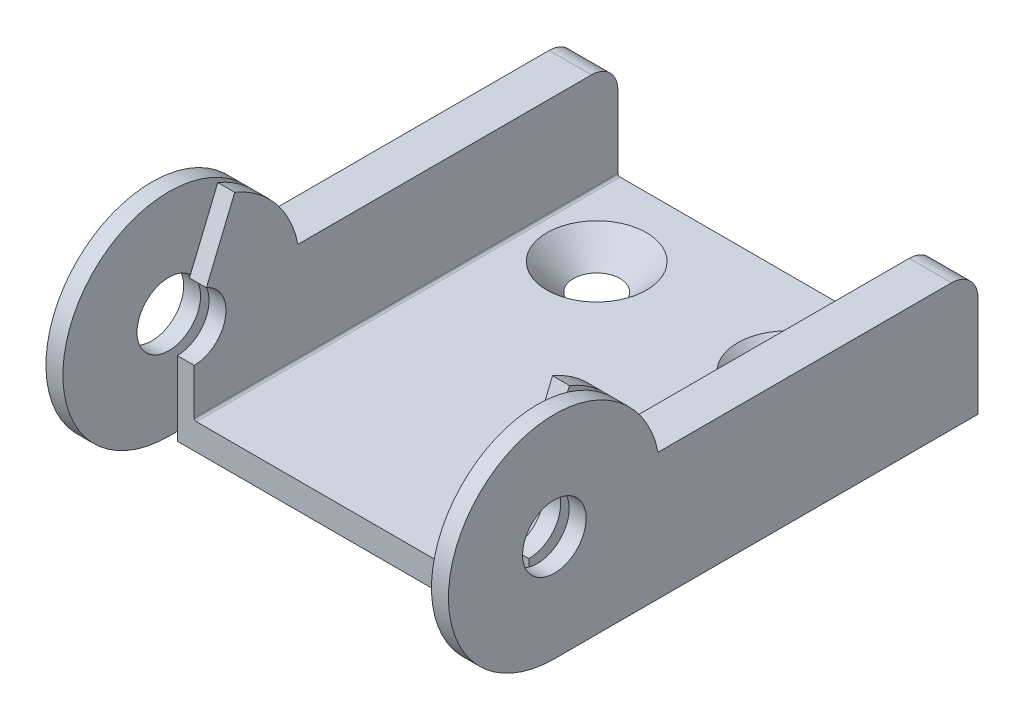
from build123d import *

# Parameters (mm, degrees)
BOSS_EXTRUDE5_START         = -16.6
BOSS_EXTRUDE5_DEPTH         = 33.2
BOSS_EXTRUDE6_DEPTH         = 0.8
BOSS_EXTRUDE7_DEPTH         = 1.6
FILLET16_R                  = 0.4
SKETCH6_R                   = 3
CUT_EXTRUDE2_DEPTH          = 46.398237851
FILLET16_OF_MIRROR1_R       = 0.4
CUT_EXTRUDE3_DEPTH          = 46.398237851
CUT_EXTRUDE3_DEPTH_BACK     = 46.398237851
FILLET_1_R                  = 2.5
HOLE_WIZARD_M42_D           = 4.2
HOLE_WIZARD_M42_DEPTH       = 8.5
HOLE_WIZARD_M42_CSINK_D     = 9.4
HOLE_WIZARD_M42_CSINK_ANGLE = 90
HOLE_WIZARD_M42_TIP         = 1.2618073


# Read off the part's stored shape, not the designer's step: Boss-Extrude5
with BuildPart() as part:
    # Boss-Extrude5 outline → Boss-Extrude5 (new body)
    with BuildSketch(Plane(origin=(0, 0, 0), x_dir=(0, 0, -1), z_dir=(1, 0, 0)).offset(BOSS_EXTRUDE5_START)):
        with BuildLine():
            Line((3.826834324, 9.238795325), (0, 0))
            Line((0, 0), (0, -10))
            Line((0, -10), (40, -10))
            Line((40, -10), (40, 2))
            Line((40, 2), (9.797958971, 2))
            ThreePointArc((9.797958971, 2), (7.7141939, 6.36327058), (3.826834324, 9.238795325))
        make_face()
    extrude(amount=BOSS_EXTRUDE5_DEPTH)

    # Sketch9 → Boss-Extrude6 (add)
    with BuildSketch(Plane(origin=(16.6, 0, 0), x_dir=(0, 0, -1), z_dir=(1, 0, 0))):
        with BuildLine():
            Line((6, 7.2), (6.939740629, 7.2))
            ThreePointArc((6.939740629, 7.2), (8.763426669, 4.816882085), (9.797958971, 2))
            Line((9.797958971, 2), (40, 2))
            Line((40, 2), (40, -7.2))
            Line((40, -7.2), (6, -7.2))
            Line((6, -7.2), (6, 7.2))
        make_face()
    boss_extrude6 = extrude(amount=BOSS_EXTRUDE6_DEPTH)

    # Sketch10 → Boss-Extrude7 (add)
    with BuildSketch(Plane(origin=(17.4, 0, 0), x_dir=(0, 0, -1), z_dir=(1, 0, 0))):
        with BuildLine():
            Line((40, 2), (40, -10))
            Line((40, -10), (0, -10))
            ThreePointArc((0, -10), (-10, 0), (0, 10))
            ThreePointArc((0, 10), (6.32455532, 7.745966692), (9.797958971, 2))
            Line((9.797958971, 2), (40, 2))
        make_face()
    boss_extrude7 = extrude(amount=BOSS_EXTRUDE7_DEPTH)

    # Fillet16
    # the kernel refuses this fillet: 0.4 mm, written as the material it takes off along each edge
    with BuildSketch(Plane(origin=(16.6, 7.2, -6), x_dir=(0, -1, 0), z_dir=(1, 0, 0)), Plane(origin=(16.6, -7.2, -6), x_dir=(0, 0, -1), z_dir=(1, 0, 0))) as fillet16_piece_1:
        with BuildLine():
            CenterArc((FILLET16_R, FILLET16_R), FILLET16_R, 180, 90)
            Line((0, FILLET16_R), (0, 0))
            Line((0, 0), (FILLET16_R, 0))
        make_face()
    extrude(amount=0.8, mode=Mode.SUBTRACT)
    # the kernel refuses this fillet: 0.4 mm, written as the material it adds along each edge
    with BuildSketch(Plane(origin=(16.6, -6.8, -6), x_dir=(0, 0, 1), z_dir=(0, 1, 0))) as fillet16_2_piece_1:
        with BuildLine():
            CenterArc((FILLET16_R, FILLET16_R), FILLET16_R, 180, 90)
            Line((0, FILLET16_R), (0, 0))
            Line((0, 0), (FILLET16_R, 0))
        make_face()
    extrude(amount=13.6)
    with BuildSketch(Plane(origin=(16.6, -7.2, -40), x_dir=(0, -1, 0), z_dir=(0, 0, 1))) as fillet16_2_piece_2:
        with BuildLine():
            CenterArc((FILLET16_R, FILLET16_R), FILLET16_R, 180, 90)
            Line((0, FILLET16_R), (0, 0))
            Line((0, 0), (FILLET16_R, 0))
        make_face()
    extrude(amount=33.6)
    with BuildSketch(Plane(origin=(16.6, 7.2, -6.4), x_dir=(0, 1, 0), z_dir=(0, 0, -1))) as fillet16_2_piece_3_section:
        with BuildLine():
            CenterArc((FILLET16_R, FILLET16_R), FILLET16_R, 180, 90)
            Line((0, FILLET16_R), (0, 0))
            Line((0, 0), (FILLET16_R, 0))
        make_face()
    fillet16_2_piece_3 = extrude(amount=1.539740629, mode=Mode.PRIVATE)
    fillet16_2_piece_3 = fillet16_2_piece_3 & Plane(origin=(16.701201478, 1e-09, -1e-09), x_dir=(0, 0.1999999999466582, -0.9797958971241596), z_dir=(-1, 0, 0)) * Cylinder(9.999999999, 5, mode=Mode.PRIVATE)
    add(fillet16_2_piece_3)
    with BuildSketch(Plane(origin=(17.4, -6.8, -6), x_dir=(0, 0, 1), z_dir=(0, 1, 0))) as fillet16_2_piece_4:
        with BuildLine():
            CenterArc((FILLET16_R, -FILLET16_R), FILLET16_R, 90, 90)
            Line((0, -FILLET16_R), (0, 0))
            Line((0, 0), (FILLET16_R, 0))
        make_face()
    extrude(amount=13.6)
    with BuildSketch(Plane(origin=(17.4, -7.2, -40), x_dir=(0, -1, 0), z_dir=(0, 0, 1))) as fillet16_2_piece_5:
        with BuildLine():
            CenterArc((FILLET16_R, -FILLET16_R), FILLET16_R, 90, 90)
            Line((0, -FILLET16_R), (0, 0))
            Line((0, 0), (FILLET16_R, 0))
        make_face()
    extrude(amount=33.6)
    with BuildSketch(Plane(origin=(17.4, 7.2, -6.4), x_dir=(-1, 0, 0), z_dir=(0, 0, -1))) as fillet16_2_piece_6_section:
        with BuildLine():
            CenterArc((FILLET16_R, FILLET16_R), FILLET16_R, 180, 90)
            Line((0, FILLET16_R), (0, 0))
            Line((0, 0), (FILLET16_R, 0))
        make_face()
    fillet16_2_piece_6 = extrude(amount=1.539740629, mode=Mode.PRIVATE)
    fillet16_2_piece_6 = fillet16_2_piece_6 & Plane(origin=(17.298798559, 1e-09, -1e-09), x_dir=(0, 0.1999999999466582, -0.9797958971241596), z_dir=(-1, 0, 0)) * Cylinder(9.999999999, 5, mode=Mode.PRIVATE)
    add(fillet16_2_piece_6)
    with BuildSketch(Plane(origin=(17.4, 6.8, -6.4), x_dir=(0, 0, 1), z_dir=(0, -1, 0))) as fillet16_2_piece_7:
        with BuildLine():
            CenterArc((0.4 + FILLET16_R, FILLET16_R), FILLET16_R, 180, 90)
            Line((0.4, FILLET16_R), (0.4, 0))
            Line((0.4, 0), (0.4 + FILLET16_R, 0))
        make_face()
    revolve(axis=Axis((17.4, 6.8, -6.4), (-1, 0, 0)), revolution_arc=90)
    with BuildSketch(Plane(origin=(17.4, -6.8, -6.4), x_dir=(0, -1, 0), z_dir=(0, 0, -1))) as fillet16_2_piece_8:
        with BuildLine():
            CenterArc((0.4 + FILLET16_R, FILLET16_R), FILLET16_R, 180, 90)
            Line((0.4, FILLET16_R), (0.4, 0))
            Line((0.4, 0), (0.4 + FILLET16_R, 0))
        make_face()
    revolve(axis=Axis((17.4, -6.8, -6.4), (-1, 0, 0)), revolution_arc=90)
    with BuildSketch(Plane(origin=(16.6, 6.8, -6.4), x_dir=(0, 0, 1), z_dir=(0, -1, 0))) as fillet16_2_piece_9:
        with BuildLine():
            CenterArc((0.4 + FILLET16_R, -FILLET16_R), FILLET16_R, 90, 90)
            Line((0.4, -FILLET16_R), (0.4, 0))
            Line((0.4, 0), (0.4 + FILLET16_R, 0))
        make_face()
    revolve(axis=Axis((16.6, 6.8, -6.4), (-1, 0, 0)), revolution_arc=90)
    with BuildSketch(Plane(origin=(16.6, -6.8, -6.4), x_dir=(0, -1, 0), z_dir=(0, 0, -1))) as fillet16_2_piece_10:
        with BuildLine():
            CenterArc((0.4 + FILLET16_R, -FILLET16_R), FILLET16_R, 90, 90)
            Line((0.4, -FILLET16_R), (0.4, 0))
            Line((0.4, 0), (0.4 + FILLET16_R, 0))
        make_face()
    revolve(axis=Axis((16.6, -6.8, -6.4), (-1, 0, 0)), revolution_arc=90)

    # Sketch6 → Cut-Extrude2 (cut, through all)
    with BuildSketch(Plane(origin=(0, 0, 0), x_dir=(0, 0, -1), z_dir=(1, 0, 0))):
        Circle(SKETCH6_R)
    cut_extrude2 = extrude(amount=CUT_EXTRUDE2_DEPTH, mode=Mode.SUBTRACT)

    # Mirror1: Boss-Extrude6, Boss-Extrude7, Cut-Extrude2 across plane
    add(boss_extrude6.mirror(Plane(origin=(0, 0, 0), x_dir=(0, 0, 1), z_dir=(1, 0, 0))))
    add(boss_extrude7.mirror(Plane(origin=(0, 0, 0), x_dir=(0, 0, 1), z_dir=(1, 0, 0))))
    add(cut_extrude2.mirror(Plane(origin=(0, 0, 0), x_dir=(0, 0, 1), z_dir=(1, 0, 0))), mode=Mode.SUBTRACT)

    # Fillet16 of Mirror1
    # the kernel refuses this fillet: 0.4 mm, written as the material it takes off along each edge
    with BuildSketch(Plane(origin=(-16.6, 7.2, -6), x_dir=(0, 0, -1), z_dir=(-1, 0, 0)), Plane(origin=(-16.6, -7.2, -6), x_dir=(0, 1, 0), z_dir=(-1, 0, 0))) as fillet16_of_mirror1_piece_1:
        with BuildLine():
            CenterArc((FILLET16_OF_MIRROR1_R, FILLET16_OF_MIRROR1_R), FILLET16_OF_MIRROR1_R, 180, 90)
            Line((0, FILLET16_OF_MIRROR1_R), (0, 0))
            Line((0, 0), (FILLET16_OF_MIRROR1_R, 0))
        make_face()
    extrude(amount=0.8, mode=Mode.SUBTRACT)
    # the kernel refuses this fillet: 0.4 mm, written as the material it adds along each edge
    with BuildSketch(Plane(origin=(-16.6, -6.8, -6), x_dir=(-1, 0, 0), z_dir=(0, 1, 0))) as fillet16_of_mirror1_2_piece_1:
        with BuildLine():
            CenterArc((FILLET16_OF_MIRROR1_R, FILLET16_OF_MIRROR1_R), FILLET16_OF_MIRROR1_R, 180, 90)
            Line((0, FILLET16_OF_MIRROR1_R), (0, 0))
            Line((0, 0), (FILLET16_OF_MIRROR1_R, 0))
        make_face()
    extrude(amount=13.6)
    with BuildSketch(Plane(origin=(-16.6, -7.2, -40), x_dir=(-1, 0, 0), z_dir=(0, 0, 1)), Plane(origin=(-17.4, -7.2, -40), x_dir=(0, -1, 0), z_dir=(0, 0, 1))) as fillet16_of_mirror1_2_piece_2:
        with BuildLine():
            CenterArc((FILLET16_OF_MIRROR1_R, FILLET16_OF_MIRROR1_R), FILLET16_OF_MIRROR1_R, 180, 90)
            Line((0, FILLET16_OF_MIRROR1_R), (0, 0))
            Line((0, 0), (FILLET16_OF_MIRROR1_R, 0))
        make_face()
    extrude(amount=33.6)
    with BuildSketch(Plane(origin=(-16.6, 7.2, -6.4), x_dir=(-1, 0, 0), z_dir=(0, 0, -1))) as fillet16_of_mirror1_2_piece_3_section:
        with BuildLine():
            CenterArc((FILLET16_OF_MIRROR1_R, FILLET16_OF_MIRROR1_R), FILLET16_OF_MIRROR1_R, 180, 90)
            Line((0, FILLET16_OF_MIRROR1_R), (0, 0))
            Line((0, 0), (FILLET16_OF_MIRROR1_R, 0))
        make_face()
    fillet16_of_mirror1_2_piece_3 = extrude(amount=1.539740629, mode=Mode.PRIVATE)
    fillet16_of_mirror1_2_piece_3 = fillet16_of_mirror1_2_piece_3 & Plane(origin=(-16.701201441, 1e-09, -1e-09), x_dir=(0, 0.1999999999466582, -0.9797958971241596), z_dir=(-1, 0, 0)) * Cylinder(9.999999999, 5, mode=Mode.PRIVATE)
    add(fillet16_of_mirror1_2_piece_3)
    with BuildSketch(Plane(origin=(-17.4, -6.8, -6), x_dir=(1, 0, 0), z_dir=(0, 1, 0))) as fillet16_of_mirror1_2_piece_4:
        with BuildLine():
            CenterArc((FILLET16_OF_MIRROR1_R, -FILLET16_OF_MIRROR1_R), FILLET16_OF_MIRROR1_R, 90, 90)
            Line((0, -FILLET16_OF_MIRROR1_R), (0, 0))
            Line((0, 0), (FILLET16_OF_MIRROR1_R, 0))
        make_face()
    extrude(amount=13.6)
    with BuildSketch(Plane(origin=(-17.4, 7.2, -6.4), x_dir=(1, 0, 0), z_dir=(0, 0, -1))) as fillet16_of_mirror1_2_piece_5_section:
        with BuildLine():
            CenterArc((FILLET16_OF_MIRROR1_R, -FILLET16_OF_MIRROR1_R), FILLET16_OF_MIRROR1_R, 90, 90)
            Line((0, -FILLET16_OF_MIRROR1_R), (0, 0))
            Line((0, 0), (FILLET16_OF_MIRROR1_R, 0))
        make_face()
    fillet16_of_mirror1_2_piece_5 = extrude(amount=1.539740629, mode=Mode.PRIVATE)
    fillet16_of_mirror1_2_piece_5 = fillet16_of_mirror1_2_piece_5 & Plane(origin=(-17.298798559, 1e-09, -1e-09), x_dir=(0, 0.1999999999466582, -0.9797958971241596), z_dir=(-1, 0, 0)) * Cylinder(9.999999999, 5, mode=Mode.PRIVATE)
    add(fillet16_of_mirror1_2_piece_5)
    with BuildSketch(Plane(origin=(-17.4, 6.8, -6.4), x_dir=(0, 1, 0), z_dir=(0, 0, -1))) as fillet16_of_mirror1_2_piece_6:
        with BuildLine():
            CenterArc((0.4 + FILLET16_OF_MIRROR1_R, FILLET16_OF_MIRROR1_R), FILLET16_OF_MIRROR1_R, 180, 90)
            Line((0.4 + FILLET16_OF_MIRROR1_R, 0), (0.4, 0))
            Line((0.4, 0), (0.4, FILLET16_OF_MIRROR1_R))
        make_face()
    revolve(axis=Axis((-17.4, 6.8, -6.4), (1, 0, 0)), revolution_arc=90)
    with BuildSketch(Plane(origin=(-17.4, -6.8, -6.4), x_dir=(0, 0, 1), z_dir=(0, 1, 0))) as fillet16_of_mirror1_2_piece_7:
        with BuildLine():
            CenterArc((0.4 + FILLET16_OF_MIRROR1_R, FILLET16_OF_MIRROR1_R), FILLET16_OF_MIRROR1_R, 180, 90)
            Line((0.4 + FILLET16_OF_MIRROR1_R, 0), (0.4, 0))
            Line((0.4, 0), (0.4, FILLET16_OF_MIRROR1_R))
        make_face()
    revolve(axis=Axis((-17.4, -6.8, -6.4), (1, 0, 0)), revolution_arc=90)
    with BuildSketch(Plane(origin=(-16.6, 6.8, -6.4), x_dir=(0, 1, 0), z_dir=(0, 0, -1))) as fillet16_of_mirror1_2_piece_8:
        with BuildLine():
            CenterArc((0.4 + FILLET16_OF_MIRROR1_R, -FILLET16_OF_MIRROR1_R), FILLET16_OF_MIRROR1_R, 90, 90)
            Line((0.4 + FILLET16_OF_MIRROR1_R, 0), (0.4, 0))
            Line((0.4, 0), (0.4, -FILLET16_OF_MIRROR1_R))
        make_face()
    revolve(axis=Axis((-16.6, 6.8, -6.4), (1, 0, 0)), revolution_arc=90)
    with BuildSketch(Plane(origin=(-16.6, -6.8, -6.4), x_dir=(0, 0, 1), z_dir=(0, 1, 0))) as fillet16_of_mirror1_2_piece_9:
        with BuildLine():
            CenterArc((0.4 + FILLET16_OF_MIRROR1_R, -FILLET16_OF_MIRROR1_R), FILLET16_OF_MIRROR1_R, 90, 90)
            Line((0.4 + FILLET16_OF_MIRROR1_R, 0), (0.4, 0))
            Line((0.4, 0), (0.4, -FILLET16_OF_MIRROR1_R))
        make_face()
    revolve(axis=Axis((-16.6, -6.8, -6.4), (1, 0, 0)), revolution_arc=90)

    # Sketch7 → Cut-Extrude3 (cut, two sides: drawn at the far end of the back side and taken through both)
    with BuildSketch(Plane.XY.offset(-CUT_EXTRUDE3_DEPTH_BACK)):
        with BuildLine():
            Line((-14.8, -7.5), (14.8, -7.5))
            ThreePointArc((14.8, -7.5), (14.941421356, -7.441421356), (15, -7.3))
            Line((15, -7.3), (15, 12.3))
            ThreePointArc((15, 12.3), (14.941421356, 12.441421356), (14.8, 12.5))
            Line((14.8, 12.5), (-14.8, 12.5))
            ThreePointArc((-14.8, 12.5), (-14.941421356, 12.441421356), (-15, 12.3))
            Line((-15, 12.3), (-15, -7.3))
            ThreePointArc((-15, -7.3), (-14.941421356, -7.441421356), (-14.8, -7.5))
        make_face()
    extrude(amount=CUT_EXTRUDE3_DEPTH + CUT_EXTRUDE3_DEPTH_BACK, mode=Mode.SUBTRACT)

    # Скругление1
    fillet_1_edges = [part.edges().sort_by_distance(p)[0] for p in [
        (17, 2, -40),
        (-17, 2, -40),
    ]]
    fillet(fillet_1_edges, radius=FILLET_1_R)

    # Зенковка для винта с полупотайной головкой M42
    with Locations(Plane(origin=(9, -7.5, -32), x_dir=(0, 0, 1), z_dir=(0, 1, 0))):
        with Locations((0, 0), (0, -18)):
            CounterSinkHole(HOLE_WIZARD_M42_D / 2, HOLE_WIZARD_M42_CSINK_D / 2, depth=HOLE_WIZARD_M42_DEPTH, counter_sink_angle=HOLE_WIZARD_M42_CSINK_ANGLE)
            with Locations((0, 0, -(HOLE_WIZARD_M42_DEPTH + HOLE_WIZARD_M42_TIP / 2))):  # 118° drill point
                Cone(0, HOLE_WIZARD_M42_D / 2, HOLE_WIZARD_M42_TIP, mode=Mode.SUBTRACT)


solid = part.part
